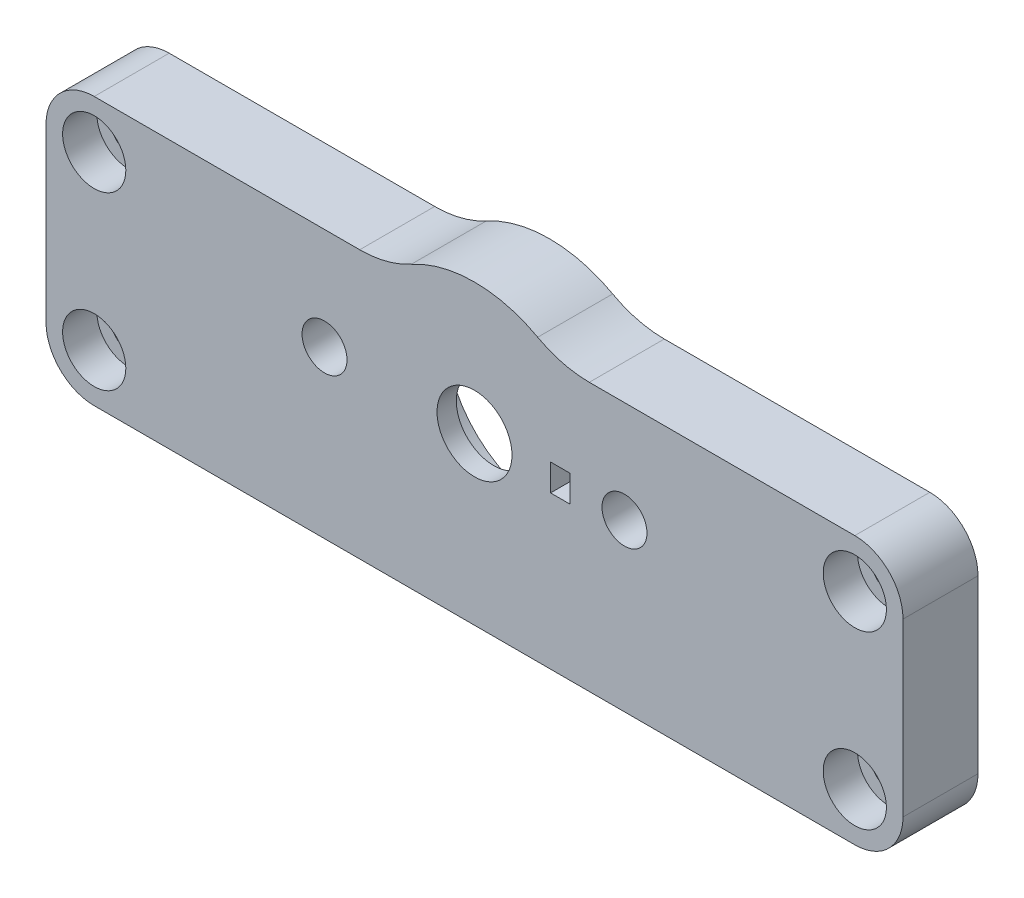
from build123d import *

# Parameters (mm, degrees)
SKETCH1_R           = 9.75
SKETCH1_R_2         = 1.65
BOSS_EXTRUDE1_DEPTH = 7
FILLET1_R           = 10
BOSS_EXTRUDE2_START = -2
SKETCH2_R           = 9.75
SKETCH2_R_2         = 7.5
BOSS_EXTRUDE2_DEPTH = 2
BOSS_EXTRUDE3_START = -1.8
SKETCH3_R           = 7.5
SKETCH3_R_2         = 3.5
BOSS_EXTRUDE3_DEPTH = 1.8
SKETCH4_W           = 1.8
SKETCH4_H           = 2.5
CUT_EXTRUDE1_DEPTH  = 2.5
SKETCH5_R           = 2.1
CUT_EXTRUDE2_DEPTH  = 3
SKETCH6_R           = 2.95
CUT_EXTRUDE3_DEPTH  = 3.2


with BuildPart() as part:
    # Sketch1 → Boss-Extrude1 (new body)
    with BuildSketch(Plane.XY):
        with BuildLine():
            Line((-35.5, 9.5), (-7.733854149, 9.5))
            ThreePointArc((-7.733854149, 9.5), (0, 12.25), (7.733854149, 9.5))
            Line((7.733854149, 9.5), (35.5, 9.5))
            ThreePointArc((35.5, 9.5), (38.681980515, 8.181980515), (40, 5))
            Line((40, 5), (40, -11))
            ThreePointArc((40, -11), (38.681980515, -14.181980515), (35.5, -15.5))
            Line((35.5, -15.5), (-35.5, -15.5))
            ThreePointArc((-35.5, -15.5), (-38.681980515, -14.181980515), (-40, -11))
            Line((-40, -11), (-40, 5))
            ThreePointArc((-40, 5), (-38.681980515, 8.181980515), (-35.5, 9.5))
        make_face()
        Circle(SKETCH1_R, mode=Mode.SUBTRACT)
        with Locations((-35.5, 5)):
            Circle(SKETCH1_R_2, mode=Mode.SUBTRACT)
        with Locations((35.5, 5)):
            Circle(SKETCH1_R_2, mode=Mode.SUBTRACT)
        with Locations((-35.5, -11)):
            Circle(SKETCH1_R_2, mode=Mode.SUBTRACT)
        with Locations((35.5, -11)):
            Circle(SKETCH1_R_2, mode=Mode.SUBTRACT)
    extrude(amount=BOSS_EXTRUDE1_DEPTH)

    # Fillet1
    fillet1_edges = [part.edges().sort_by_distance(p)[0] for p in [
        (7.733854149, 9.5, 3.5),
        (-7.733854149, 9.5, 3.5),
    ]]
    fillet(fillet1_edges, radius=FILLET1_R)

    # Sketch2 → Boss-Extrude2 (add)
    with BuildSketch(Plane.XY.offset(7).offset(BOSS_EXTRUDE2_START)):
        Circle(SKETCH2_R)
        Circle(SKETCH2_R_2, mode=Mode.SUBTRACT)
    extrude(amount=BOSS_EXTRUDE2_DEPTH)

    # Sketch3 → Boss-Extrude3 (add)
    with BuildSketch(Plane.XY.offset(7).offset(BOSS_EXTRUDE3_START)):
        Circle(SKETCH3_R)
        Circle(SKETCH3_R_2, mode=Mode.SUBTRACT)
    extrude(amount=BOSS_EXTRUDE3_DEPTH)

    # Sketch4 → Cut-Extrude1 (cut)
    with BuildSketch(Plane.XY.offset(7)):
        with Locations((8, 0)):
            Rectangle(SKETCH4_W, SKETCH4_H)
    extrude(amount=-CUT_EXTRUDE1_DEPTH, mode=Mode.SUBTRACT)

    # Sketch5 → Cut-Extrude2 (cut)
    with BuildSketch(Plane.XY.offset(7)):
        with Locations((-14, 0)):
            Circle(SKETCH5_R)
        with Locations((14, 0)):
            Circle(SKETCH5_R)
    extrude(amount=-CUT_EXTRUDE2_DEPTH, mode=Mode.SUBTRACT)

    # Sketch6 → Cut-Extrude3 (cut)
    with BuildSketch(Plane.XY.offset(7)):
        with Locations((-35.5, 5)):
            Circle(SKETCH6_R)
        with Locations((-35.5, -11)):
            Circle(SKETCH6_R)
        with Locations((35.5, -11)):
            Circle(SKETCH6_R)
        with Locations((35.5, 5)):
            Circle(SKETCH6_R)
    extrude(amount=-CUT_EXTRUDE3_DEPTH, mode=Mode.SUBTRACT)


solid = part.part
